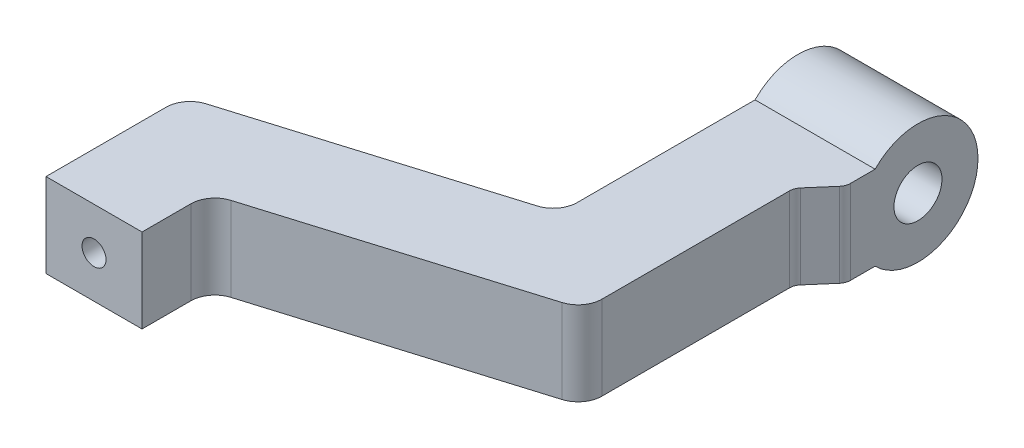
from build123d import *

# Parameters (mm, degrees)
BOSS_EXTRUDE2_DEPTH = 3.5
SKETCH3_R           = 2.5
BOSS_EXTRUDE3_DEPTH = 5
FILLET2_R           = 0.5
SKETCH5_R           = 0.5
CUT_EXTRUDE1_DEPTH  = 1
SKETCH6_R           = 1
CUT_EXTRUDE2_DEPTH  = 37.253196766


with BuildPart() as part:
    # Sketch2 → Boss-Extrude2 (new body)
    with BuildSketch(Plane(origin=(0, 0, 0), x_dir=(1, 0, 0), z_dir=(0, 1, 0))):
        with BuildLine():
            Line((-1.500662684, 17.128376176), (-1.500662684, 12.128376176))
            Line((-1.500662684, 12.128376176), (2.499337316, 12.128376176))
            Line((2.499337316, 12.128376176), (2.499337316, 14.162218976))
            ThreePointArc((2.499337316, 14.162218976), (2.696087031, 14.75786063), (3.208915276, 15.119117632))
            Line((3.208915276, 15.119117632), (13.789759356, 18.330440279))
            ThreePointArc((13.789759356, 18.330440279), (14.302587601, 18.691697281), (14.499337316, 19.287338935))
            Line((14.499337316, 19.287338935), (14.499337316, 27.287338935))
            Line((14.499337316, 27.287338935), (15.499337316, 28.444539704))
            Line((15.499337316, 28.444539704), (15.499337316, 28.878255261))
            Line((15.499337316, 28.878255261), (15.499337316, 31.444539704))
            Line((15.499337316, 31.444539704), (10.499337316, 31.444539704))
            Line((10.499337316, 31.444539704), (10.499337316, 26.210120497))
            Line((10.499337316, 26.210120497), (10.499337316, 22.253496135))
            ThreePointArc((10.499337316, 22.253496135), (10.302587601, 21.657854481), (9.789759356, 21.296597478))
            Line((9.789759356, 21.296597478), (-0.791084724, 18.085274832))
            ThreePointArc((-0.791084724, 18.085274832), (-1.303912969, 17.724017829), (-1.500662684, 17.128376176))
        make_face()
    extrude(amount=BOSS_EXTRUDE2_DEPTH)

    # Sketch3 → Boss-Extrude3 (add)
    with BuildSketch(Plane.ZY.offset(-10.499337316)):
        with Locations((-31.444539704, 1.75)):
            Circle(SKETCH3_R)
    extrude(amount=-BOSS_EXTRUDE3_DEPTH)

    # Fillet2
    fillet2_edges = [part.edges().sort_by_distance(p)[0] for p in [
        (14.499337316, 1.75, -27.287338935),
        (15.499337316, 1.75, -28.444539704),
    ]]
    fillet(fillet2_edges, radius=FILLET2_R)

    # Sketch5 → Cut-Extrude1 (cut)
    with BuildSketch(Plane.XY.offset(-12.128376176)):
        with Locations((0.499337316, 1.75)):
            Circle(SKETCH5_R)
    extrude(amount=-CUT_EXTRUDE1_DEPTH, mode=Mode.SUBTRACT)

    # Sketch6 → Cut-Extrude2 (cut, through all)
    with BuildSketch(Plane.ZY.offset(-10.499337316)):
        with Locations((-31.444539704, 1.75)):
            Circle(SKETCH6_R)
    extrude(amount=-CUT_EXTRUDE2_DEPTH, mode=Mode.SUBTRACT)


solid = part.part
